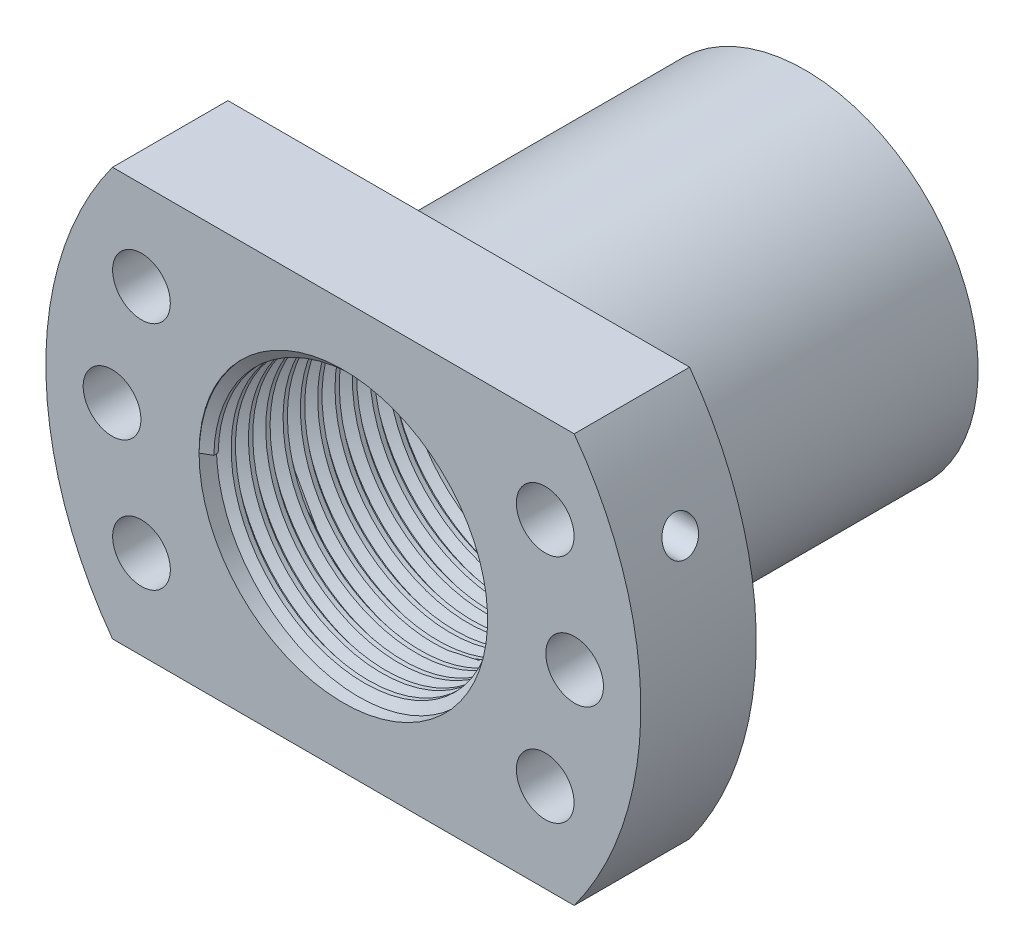
from build123d import *
from build123d.topology import SkipClean

# Parameters (mm, degrees)
BOSS_EXTRUDE1_DEPTH     = 10
SKETCH2_R               = 15
BOSS_EXTRUDE2_DEPTH     = 30
SKETCH3_R               = 12.5
CUT_EXTRUDE1_DEPTH      = 51.768571
THREAD1_PITCH           = 1.5
SKETCH6_R               = 2.5
CUT_EXTRUDE2_DEPTH      = 20
CUT_EXTRUDE3_DEPTH      = 51.768571164
CUT_EXTRUDE3_DEPTH_BACK = 51.768571164
SKETCH7_R               = 1.5


with BuildPart() as part:
    # Sketch1 → Boss-Extrude1 (new body)
    with BuildSketch(Plane.XY):
        with BuildLine():
            Line((-20, -17.6953125), (20, -17.6953125))
            ThreePointArc((20, -17.6953125), (25.774478013, 0), (20, 17.6953125))
            Line((20, 17.6953125), (-20, 17.6953125))
            ThreePointArc((-20, 17.6953125), (-25.774478013, 0), (-20, -17.6953125))
        make_face()
    extrude(amount=-BOSS_EXTRUDE1_DEPTH)

    # Sketch2 → Boss-Extrude2 (add)
    with BuildSketch(Plane(origin=(0, 0, -10), x_dir=(-1, 0, 0), z_dir=(0, 0, -1))):
        Circle(SKETCH2_R)
    extrude(amount=BOSS_EXTRUDE2_DEPTH)

    # Sketch3 → Cut-Extrude1 (cut, through all)
    with BuildSketch(Plane.XY):
        Circle(SKETCH3_R)
    extrude(amount=-CUT_EXTRUDE1_DEPTH, mode=Mode.SUBTRACT)

    # Thread1: the profile of Thread Profile1 profile screwed along a right-hand helix of 25.333333 turns, 8 arcs to a turn; built about Z, then put on its axis
    with SkipClean():  # the faces are left unmerged after this step: merging them gives an invalid solid
        thread1_z = Axis((0, 0, 0), (0, 0, 1))
        thread1_corners = [(12.5003, 0, -0.000173205), (12.5003, 0, 1.312673201), (11.688101187, 0, 0.843749998), (11.688101187, 0, 0.468749998)]
        with BuildLine(mode=Mode.PRIVATE) as thread1_profile:
            Line(thread1_corners[0], thread1_corners[1])
            Line(thread1_corners[1], thread1_corners[2])
            Line(thread1_corners[2], thread1_corners[3])
            Line(thread1_corners[3], thread1_corners[0])
        thread1_cap = Face(thread1_profile.wire())
        thread1_turn_angles = [0, 22.5, 45, 67.5, 90, 112.5, 135, 157.5, 180, 202.5, 225, 247.5, 270, 292.5, 315, 337.5, 360]
        thread1_turn_weights = [1, 0.9238795325112867, 1, 0.9238795325112867, 1, 0.9238795325112867, 1, 0.9238795325112867, 1, 0.9238795325112867, 1, 0.9238795325112867, 1, 0.9238795325112867, 1, 0.9238795325112867, 1]
        thread1_turn_rails = [Edge.make_bspline([Vector(p[0], p[1], 0).rotate(thread1_z, thread1_turn_angles[k]) / thread1_turn_weights[k] + Vector(0, 0, p[2] + THREAD1_PITCH * thread1_turn_angles[k] / 360) for k in range(17)], [0, 0, 0, 1, 1, 2, 2, 3, 3, 4, 4, 5, 5, 6, 6, 7, 7, 8, 8, 8], 2, thread1_turn_weights) for p in thread1_corners]
        thread1_turn_sides = [Face.make_surface_from_curves(thread1_turn_rails[p[0]], thread1_turn_rails[p[1]]) for p in [(0, 1), (1, 2), (2, 3), (3, 0)]]
        thread1_last_angles = [9000, 9022.5, 9045, 9067.5, 9090, 9105, 9120]
        thread1_last_weights = [1, 0.9238795325112867, 1, 0.9238795325112867, 1, 0.9659258262890724, 1]
        thread1_last_rails = [Edge.make_bspline([Vector(p[0], p[1], 0).rotate(thread1_z, thread1_last_angles[k]) / thread1_last_weights[k] + Vector(0, 0, p[2] + THREAD1_PITCH * thread1_last_angles[k] / 360) for k in range(7)], [0, 0, 0, 1, 1, 2, 2, 3, 3, 3], 2, thread1_last_weights) for p in thread1_corners]
        thread1_last_sides = [Face.make_surface_from_curves(thread1_last_rails[p[0]], thread1_last_rails[p[1]]) for p in [(0, 1), (1, 2), (2, 3), (3, 0)]]
        thread1 = Plane(origin=(0, 0, 0), x_dir=(-1, 0, 0), z_dir=(0, 0, -1)) * Solid(Shell([*[p.moved(Location((0, 0, THREAD1_PITCH * i))) for i in range(25) for p in thread1_turn_sides], *thread1_last_sides, thread1_cap, thread1_cap.rotate(thread1_z, 9120).moved(Location((0, 0, THREAD1_PITCH * 9120 / 360)))]))
        add(thread1)

    # Sketch6 → Cut-Extrude2 (cut)
    with BuildSketch(Plane.XY):
        with Locations((-17.489764663, 10)):
            Circle(SKETCH6_R)
        with Locations((-20.038524337, 0)):
            Circle(SKETCH6_R)
        with Locations(Location((20.038524337, 0, 0), (0, 0, 180))):
            Circle(SKETCH6_R)
        with Locations(Location((17.489764663, 10, 0), (0, 0, 180))):
            Circle(SKETCH6_R)
        with Locations((17.489764663, -10)):
            Circle(SKETCH6_R)
        with Locations(Location((-17.489764663, -10, 0), (0, 0, 180))):
            Circle(SKETCH6_R)
    extrude(amount=-CUT_EXTRUDE2_DEPTH, mode=Mode.SUBTRACT)

    # Sketch7 → Cut-Extrude3 (cut, two sides: drawn at the far end of the back side and taken through both)
    with BuildSketch(Plane(origin=(0, 0, 0), x_dir=(0, 0, -1), z_dir=(1, 0, 0)).offset(-CUT_EXTRUDE3_DEPTH_BACK)):
        with Locations((5, 9.613944566)):
            Circle(SKETCH7_R)
    extrude(amount=CUT_EXTRUDE3_DEPTH + CUT_EXTRUDE3_DEPTH_BACK, mode=Mode.SUBTRACT)


solid = part.part
